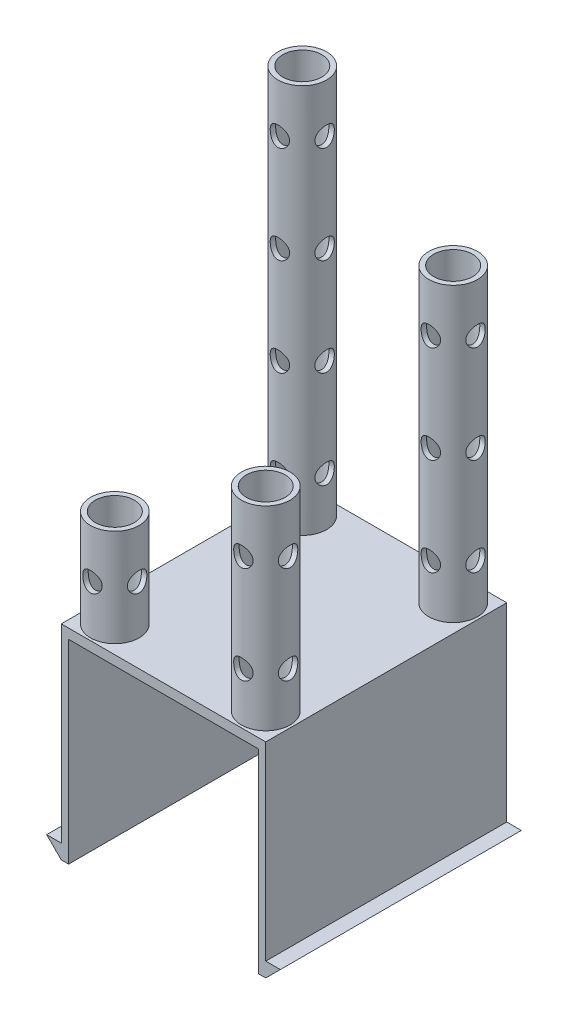
from build123d import *

# Parameters (mm, degrees)
SKETCH1_R                  = 30
SKETCH1_R_2                = 27.5
BOSS_EXTRUDE1_DEPTH        = 100
SKETCH1_2_R                = 27.5
BOSS_EXTRUDE2_DEPTH        = 5
SKETCH2_W                  = 1.5
SKETCH2_H                  = 49.5
BOSS_EXTRUDE3_DEPTH        = 40
SKETCH3_W                  = 42
SKETCH3_H                  = 49.5
BOSS_EXTRUDE4_DEPTH        = 2
BOSS_EXTRUDE5_DEPTH        = 49.5
SKETCH5_W                  = 73.198531936
SKETCH5_H                  = 63.388419408
CUT_EXTRUDE1_DEPTH         = 100
CUT_EXTRUDE2_START         = -5
CUT_EXTRUDE2_DEPTH         = 5
SKETCH8_R                  = 5
SKETCH8_R_2                = 4
BOSS_EXTRUDE6_DEPTH        = 80
SKETCH9_R                  = 2
CUT_EXTRUDE3_DEPTH         = 20
CIRPATTERN1_COUNT          = 4
LPATTERN1_COUNT            = 4
LPATTERN1_PITCH            = 20
LPATTERN1_COPY_1_SKETCH_R  = 2
LPATTERN1_COPY_1_DEPTH     = 20
LPATTERN1_COPY_2_SKETCH_R  = 2
LPATTERN1_COPY_2_DEPTH     = 20
LPATTERN1_COPY_3_SKETCH_R  = 2
LPATTERN1_COPY_3_DEPTH     = 20
LPATTERN1_COPY_4_SKETCH_R  = 2
LPATTERN1_COPY_4_DEPTH     = 20
LPATTERN1_COPY_5_SKETCH_R  = 2
LPATTERN1_COPY_5_DEPTH     = 20
LPATTERN1_COPY_6_SKETCH_R  = 2
LPATTERN1_COPY_6_DEPTH     = 20
LPATTERN1_COPY_7_SKETCH_R  = 2
LPATTERN1_COPY_7_DEPTH     = 20
LPATTERN1_COPY_8_SKETCH_R  = 2
LPATTERN1_COPY_8_DEPTH     = 20
LPATTERN1_COPY_9_SKETCH_R  = 2
LPATTERN1_COPY_9_DEPTH     = 20
LPATTERN2_COUNT            = 2
LPATTERN2_PITCH            = 38.5
LPATTERN2_COPY_1_SKETCH_R  = 2
LPATTERN2_COPY_1_DEPTH     = 20
LPATTERN2_COPY_2_SKETCH_R  = 2
LPATTERN2_COPY_2_DEPTH     = 20
LPATTERN2_COPY_3_SKETCH_R  = 2
LPATTERN2_COPY_3_DEPTH     = 20
LPATTERN2_COPY_4_SKETCH_R  = 2
LPATTERN2_COPY_4_DEPTH     = 20
LPATTERN2_COPY_5_SKETCH_R  = 2
LPATTERN2_COPY_5_DEPTH     = 20
LPATTERN2_COPY_6_SKETCH_R  = 2
LPATTERN2_COPY_6_DEPTH     = 20
LPATTERN2_COPY_7_SKETCH_R  = 2
LPATTERN2_COPY_7_DEPTH     = 20
LPATTERN2_COPY_8_SKETCH_R  = 2
LPATTERN2_COPY_8_DEPTH     = 20
LPATTERN2_COPY_9_SKETCH_R  = 2
LPATTERN2_COPY_9_DEPTH     = 20
LPATTERN2_COPY_10_SKETCH_R = 2
LPATTERN2_COPY_10_DEPTH    = 20
LPATTERN2_COPY_11_SKETCH_R = 2
LPATTERN2_COPY_11_DEPTH    = 20
LPATTERN2_COPY_12_SKETCH_R = 2
LPATTERN2_COPY_12_DEPTH    = 20
LPATTERN2_COPY_13_SKETCH_R = 2
LPATTERN2_COPY_13_DEPTH    = 20
LPATTERN2_COPY_14_SKETCH_R = 2
LPATTERN2_COPY_14_DEPTH    = 20
LPATTERN2_COPY_15_SKETCH_R = 2
LPATTERN2_COPY_15_DEPTH    = 20
LPATTERN3_COUNT            = 2
LPATTERN3_PITCH            = 31
LPATTERN3_COPY_1_SKETCH_R  = 2
LPATTERN3_COPY_1_DEPTH     = 20
LPATTERN3_COPY_2_SKETCH_R  = 2
LPATTERN3_COPY_2_DEPTH     = 20
LPATTERN3_COPY_3_SKETCH_R  = 2
LPATTERN3_COPY_3_DEPTH     = 20
LPATTERN3_COPY_4_SKETCH_R  = 2
LPATTERN3_COPY_4_DEPTH     = 20
LPATTERN3_COPY_5_SKETCH_R  = 2
LPATTERN3_COPY_5_DEPTH     = 20
LPATTERN3_COPY_6_SKETCH_R  = 2
LPATTERN3_COPY_6_DEPTH     = 20
LPATTERN3_COPY_7_SKETCH_R  = 2
LPATTERN3_COPY_7_DEPTH     = 20
LPATTERN3_COPY_8_SKETCH_R  = 2
LPATTERN3_COPY_8_DEPTH     = 20
LPATTERN3_COPY_9_SKETCH_R  = 2
LPATTERN3_COPY_9_DEPTH     = 20
LPATTERN3_COPY_10_SKETCH_R = 2
LPATTERN3_COPY_10_DEPTH    = 20
LPATTERN3_COPY_11_SKETCH_R = 2
LPATTERN3_COPY_11_DEPTH    = 20
LPATTERN3_COPY_12_SKETCH_R = 2
LPATTERN3_COPY_12_DEPTH    = 20
LPATTERN3_COPY_13_SKETCH_R = 2
LPATTERN3_COPY_13_DEPTH    = 20
LPATTERN3_COPY_14_SKETCH_R = 2
LPATTERN3_COPY_14_DEPTH    = 20
LPATTERN3_COPY_15_SKETCH_R = 2
LPATTERN3_COPY_15_DEPTH    = 20
LPATTERN3_COPY_16_SKETCH_R = 2
LPATTERN3_COPY_16_DEPTH    = 20
LPATTERN3_COPY_17_SKETCH_R = 2
LPATTERN3_COPY_17_DEPTH    = 20
LPATTERN3_COPY_18_SKETCH_R = 2
LPATTERN3_COPY_18_DEPTH    = 20
LPATTERN3_COPY_19_SKETCH_R = 2
LPATTERN3_COPY_19_DEPTH    = 20
LPATTERN3_COPY_20_SKETCH_R = 2
LPATTERN3_COPY_20_DEPTH    = 20
LPATTERN3_COPY_21_SKETCH_R = 2
LPATTERN3_COPY_21_DEPTH    = 20
LPATTERN3_COPY_22_SKETCH_R = 2
LPATTERN3_COPY_22_DEPTH    = 20
LPATTERN3_COPY_23_SKETCH_R = 2
LPATTERN3_COPY_23_DEPTH    = 20
LPATTERN3_COPY_24_SKETCH_R = 2
LPATTERN3_COPY_24_DEPTH    = 20
LPATTERN3_COPY_25_SKETCH_R = 2
LPATTERN3_COPY_25_DEPTH    = 20
LPATTERN3_COPY_26_SKETCH_R = 2
LPATTERN3_COPY_26_DEPTH    = 20
LPATTERN3_COPY_27_SKETCH_R = 2
LPATTERN3_COPY_27_DEPTH    = 20
LPATTERN3_COPY_28_SKETCH_R = 2
LPATTERN3_COPY_28_DEPTH    = 20
LPATTERN3_COPY_29_SKETCH_R = 2
LPATTERN3_COPY_29_DEPTH    = 20
LPATTERN3_COPY_30_SKETCH_R = 2
LPATTERN3_COPY_30_DEPTH    = 20
LPATTERN3_COPY_31_SKETCH_R = 2
LPATTERN3_COPY_31_DEPTH    = 20
CUT_EXTRUDE4_START         = -20
SKETCH10_R                 = 5
SKETCH10_R_2               = 4
CUT_EXTRUDE4_DEPTH         = 20
SKETCH10_3_W               = 25.68894856
SKETCH10_3_H               = 21.279129053
CUT_EXTRUDE5_DEPTH         = 40
SKETCH10_4_W               = 21.279129053
SKETCH10_4_H               = 18.199255111
CUT_EXTRUDE6_DEPTH         = 60


with BuildPart() as part:
    # Sketch1 → Boss-Extrude1 (new body)
    with BuildSketch(Plane(origin=(0, 0, 0), x_dir=(1, 0, 0), z_dir=(0, 1, 0))):
        with Locations(Location((0, 0, 0), (0, 0, 270))):
            Circle(SKETCH1_R)
        with Locations(Location((0, 0, 0), (0, 0, 270))):
            Circle(SKETCH1_R_2, mode=Mode.SUBTRACT)
    extrude(amount=BOSS_EXTRUDE1_DEPTH)

    # Sketch1<2> → Boss-Extrude2 (add)
    with BuildSketch(Plane(origin=(0, 0, 0), x_dir=(1, 0, 0), z_dir=(0, 1, 0))):
        with Locations(Location((0, 0, 0), (0, 0, 270))):
            Circle(SKETCH1_2_R)
    extrude(amount=BOSS_EXTRUDE2_DEPTH)

    # Sketch2 → Boss-Extrude3 (add)
    with BuildSketch(Plane.XZ):
        with Locations((-20.25, 0)):
            Rectangle(SKETCH2_W, SKETCH2_H)
        with Locations((20.25, 0)):
            Rectangle(SKETCH2_W, SKETCH2_H)
    extrude(amount=BOSS_EXTRUDE3_DEPTH)

    # Sketch3 → Boss-Extrude4 (add)
    with BuildSketch(Plane.XZ):
        Rectangle(SKETCH3_W, SKETCH3_H)
    extrude(amount=-BOSS_EXTRUDE4_DEPTH)

    # Sketch4 → Boss-Extrude5 (add)
    with BuildSketch(Plane(origin=(0, 0, -24.75), x_dir=(-1, 0, 0), z_dir=(0, 0, -1))):
        Polygon((21, -40), (24, -37), (21, -37), align=None)
        Polygon((-21, -40), (-24, -37), (-21, -37), align=None)
    extrude(amount=-BOSS_EXTRUDE5_DEPTH)

    # Sketch5 → Cut-Extrude1 (cut)
    with BuildSketch(Plane(origin=(0, 2, 0), x_dir=(1, 0, 0), z_dir=(0, 1, 0))):
        with Locations((-1.760789428, 1.131936061)):
            Rectangle(SKETCH5_W, SKETCH5_H)
    extrude(amount=CUT_EXTRUDE1_DEPTH, mode=Mode.SUBTRACT)

    # Sketch7 → Cut-Extrude2 (cut)
    with BuildSketch(Plane(origin=(0, 2, 0), x_dir=(1, 0, 0), z_dir=(0, 1, 0)).offset(CUT_EXTRUDE2_START)):
        with BuildLine():
            Line((-21, 24.75), (-27.699143617, 24.75))
            Line((-27.699143617, 24.75), (-38.524669613, 24.75))
            Line((-38.524669613, 24.75), (-38.524669613, -26.230735856))
            Line((-38.524669613, -26.230735856), (-25.435271495, -26.230735856))
            Line((-25.435271495, -26.230735856), (-25.435271495, -24.75))
            Line((-25.435271495, -24.75), (-21, -24.75))
            Line((-21, -24.75), (-21, -21.424285286))
            ThreePointArc((-21, -21.424285286), (-30, 0), (-21, 21.424285286))
            Line((-21, 21.424285286), (-21, 24.75))
        make_face()
        with BuildLine():
            Line((-21, -21.424285286), (-21, 21.424285286))
            ThreePointArc((-21, 21.424285286), (-30, 0), (-21, -21.424285286))
        make_face()
        with BuildLine():
            ThreePointArc((16.953981833, 24.75), (0, 30), (-16.953981833, 24.75))
            Line((-16.953981833, 24.75), (16.953981833, 24.75))
        make_face()
        with BuildLine():
            ThreePointArc((21, -21.424285286), (30, 0), (21, 21.424285286))
            Line((21, 21.424285286), (21, -21.424285286))
        make_face()
        with BuildLine():
            Line((16.953981833, -24.75), (-16.953981833, -24.75))
            ThreePointArc((-16.953981833, -24.75), (0, -30), (16.953981833, -24.75))
        make_face()
    extrude(amount=CUT_EXTRUDE2_DEPTH, mode=Mode.SUBTRACT)

    # Sketch8 → Boss-Extrude6 (add)
    # profile 1 of 4: a face of its own
    with BuildSketch(Plane(origin=(0, 2, 0), x_dir=(1, 0, 0), z_dir=(0, 1, 0))):
        with Locations(Location((-15.5, 19.25, 0), (0, 0, 270))):
            Circle(SKETCH8_R)
        with Locations(Location((-15.5, 19.25, 0), (0, 0, 270))):
            Circle(SKETCH8_R_2, mode=Mode.SUBTRACT)
    # profile 2 of 4: a face of its own
    with BuildSketch(Plane(origin=(0, 2, 0), x_dir=(1, 0, 0), z_dir=(0, 1, 0))):
        with Locations(Location((15.5, 19.25, 0), (0, 0, 270))):
            Circle(SKETCH8_R)
        with Locations(Location((15.5, 19.25, 0), (0, 0, 270))):
            Circle(SKETCH8_R_2, mode=Mode.SUBTRACT)
    # profile 3 of 4: a face of its own
    with BuildSketch(Plane(origin=(0, 2, 0), x_dir=(1, 0, 0), z_dir=(0, 1, 0))):
        with Locations(Location((-15.5, -19.25, 0), (0, 0, 270))):
            Circle(SKETCH8_R)
        with Locations(Location((-15.5, -19.25, 0), (0, 0, 270))):
            Circle(SKETCH8_R_2, mode=Mode.SUBTRACT)
    # profile 4 of 4: a face of its own
    with BuildSketch(Plane(origin=(0, 2, 0), x_dir=(1, 0, 0), z_dir=(0, 1, 0))):
        with Locations(Location((15.5, -19.25, 0), (0, 0, 270))):
            Circle(SKETCH8_R)
        with Locations(Location((15.5, -19.25, 0), (0, 0, 270))):
            Circle(SKETCH8_R_2, mode=Mode.SUBTRACT)
    extrude(amount=BOSS_EXTRUDE6_DEPTH)

    # Sketch9 → Cut-Extrude3 (cut)
    with BuildSketch(Plane.ZY.offset(21)):
        with Locations((-19.25, 72)):
            Circle(SKETCH9_R)
    cut_extrude3 = extrude(amount=-CUT_EXTRUDE3_DEPTH, mode=Mode.SUBTRACT)

    # CirPattern1: Cut-Extrude3 ×4 about axis
    cirpattern1_axis = Axis((-15.5, 82, -19.25), (0, 1, 0))
    for i in range(1, CIRPATTERN1_COUNT):
        add(cut_extrude3.rotate(cirpattern1_axis, i * 360 / CIRPATTERN1_COUNT), mode=Mode.SUBTRACT)

    # LPattern1: Cut-Extrude3 ×4
    with Locations(*[(0, -i * LPATTERN1_PITCH, 0) for i in range(1, LPATTERN1_COUNT)]):
        add(cut_extrude3, mode=Mode.SUBTRACT)

    # LPattern1 copy 1 sketch → LPattern1 copy 1 (cut)
    with BuildSketch(Plane(origin=(3.75, -20, -13.75), x_dir=(1, 0, 0), z_dir=(0, 0, 1))):
        with Locations((-19.25, 72)):
            Circle(LPATTERN1_COPY_1_SKETCH_R)
    extrude(amount=-LPATTERN1_COPY_1_DEPTH, mode=Mode.SUBTRACT)

    # LPattern1 copy 2 sketch → LPattern1 copy 2 (cut)
    with BuildSketch(Plane(origin=(3.75, -40, -13.75), x_dir=(1, 0, 0), z_dir=(0, 0, 1))):
        with Locations((-19.25, 72)):
            Circle(LPATTERN1_COPY_2_SKETCH_R)
    extrude(amount=-LPATTERN1_COPY_2_DEPTH, mode=Mode.SUBTRACT)

    # LPattern1 copy 3 sketch → LPattern1 copy 3 (cut)
    with BuildSketch(Plane(origin=(3.75, -60, -13.75), x_dir=(1, 0, 0), z_dir=(0, 0, 1))):
        with Locations((-19.25, 72)):
            Circle(LPATTERN1_COPY_3_SKETCH_R)
    extrude(amount=-LPATTERN1_COPY_3_DEPTH, mode=Mode.SUBTRACT)

    # LPattern1 copy 4 sketch → LPattern1 copy 4 (cut)
    with BuildSketch(Plane(origin=(-10, -20, -38.5), x_dir=(0, 0, -1), z_dir=(1, 0, 0))):
        with Locations((-19.25, 72)):
            Circle(LPATTERN1_COPY_4_SKETCH_R)
    extrude(amount=-LPATTERN1_COPY_4_DEPTH, mode=Mode.SUBTRACT)

    # LPattern1 copy 5 sketch → LPattern1 copy 5 (cut)
    with BuildSketch(Plane(origin=(-10, -40, -38.5), x_dir=(0, 0, -1), z_dir=(1, 0, 0))):
        with Locations((-19.25, 72)):
            Circle(LPATTERN1_COPY_5_SKETCH_R)
    extrude(amount=-LPATTERN1_COPY_5_DEPTH, mode=Mode.SUBTRACT)

    # LPattern1 copy 6 sketch → LPattern1 copy 6 (cut)
    with BuildSketch(Plane(origin=(-10, -60, -38.5), x_dir=(0, 0, -1), z_dir=(1, 0, 0))):
        with Locations((-19.25, 72)):
            Circle(LPATTERN1_COPY_6_SKETCH_R)
    extrude(amount=-LPATTERN1_COPY_6_DEPTH, mode=Mode.SUBTRACT)

    # LPattern1 copy 7 sketch → LPattern1 copy 7 (cut)
    with BuildSketch(Plane(origin=(-34.75, -20, -24.75), x_dir=(-1, 0, 0), z_dir=(0, 0, -1))):
        with Locations((-19.25, 72)):
            Circle(LPATTERN1_COPY_7_SKETCH_R)
    extrude(amount=-LPATTERN1_COPY_7_DEPTH, mode=Mode.SUBTRACT)

    # LPattern1 copy 8 sketch → LPattern1 copy 8 (cut)
    with BuildSketch(Plane(origin=(-34.75, -40, -24.75), x_dir=(-1, 0, 0), z_dir=(0, 0, -1))):
        with Locations((-19.25, 72)):
            Circle(LPATTERN1_COPY_8_SKETCH_R)
    extrude(amount=-LPATTERN1_COPY_8_DEPTH, mode=Mode.SUBTRACT)

    # LPattern1 copy 9 sketch → LPattern1 copy 9 (cut)
    with BuildSketch(Plane(origin=(-34.75, -60, -24.75), x_dir=(-1, 0, 0), z_dir=(0, 0, -1))):
        with Locations((-19.25, 72)):
            Circle(LPATTERN1_COPY_9_SKETCH_R)
    extrude(amount=-LPATTERN1_COPY_9_DEPTH, mode=Mode.SUBTRACT)

    # LPattern2: Cut-Extrude3 ×2
    with Locations(*[(0, 0, i * LPATTERN2_PITCH) for i in range(1, LPATTERN2_COUNT)]):
        add(cut_extrude3, mode=Mode.SUBTRACT)

    # LPattern2 copy 1 sketch → LPattern2 copy 1 (cut)
    with BuildSketch(Plane(origin=(3.75, 0, 24.75), x_dir=(1, 0, 0), z_dir=(0, 0, 1))):
        with Locations((-19.25, 72)):
            Circle(LPATTERN2_COPY_1_SKETCH_R)
    extrude(amount=-LPATTERN2_COPY_1_DEPTH, mode=Mode.SUBTRACT)

    # LPattern2 copy 2 sketch → LPattern2 copy 2 (cut)
    with BuildSketch(Plane(origin=(-10, 0, 0), x_dir=(0, 0, -1), z_dir=(1, 0, 0))):
        with Locations((-19.25, 72)):
            Circle(LPATTERN2_COPY_2_SKETCH_R)
    extrude(amount=-LPATTERN2_COPY_2_DEPTH, mode=Mode.SUBTRACT)

    # LPattern2 copy 3 sketch → LPattern2 copy 3 (cut)
    with BuildSketch(Plane(origin=(-34.75, 0, 13.75), x_dir=(-1, 0, 0), z_dir=(0, 0, -1))):
        with Locations((-19.25, 72)):
            Circle(LPATTERN2_COPY_3_SKETCH_R)
    extrude(amount=-LPATTERN2_COPY_3_DEPTH, mode=Mode.SUBTRACT)

    # LPattern2 copy 4 sketch → LPattern2 copy 4 (cut)
    with BuildSketch(Plane(origin=(-21, -20, 38.5), x_dir=(0, 0, 1), z_dir=(-1, 0, 0))):
        with Locations((-19.25, 72)):
            Circle(LPATTERN2_COPY_4_SKETCH_R)
    extrude(amount=-LPATTERN2_COPY_4_DEPTH, mode=Mode.SUBTRACT)

    # LPattern2 copy 5 sketch → LPattern2 copy 5 (cut)
    with BuildSketch(Plane(origin=(-21, -40, 38.5), x_dir=(0, 0, 1), z_dir=(-1, 0, 0))):
        with Locations((-19.25, 72)):
            Circle(LPATTERN2_COPY_5_SKETCH_R)
    extrude(amount=-LPATTERN2_COPY_5_DEPTH, mode=Mode.SUBTRACT)

    # LPattern2 copy 6 sketch → LPattern2 copy 6 (cut)
    with BuildSketch(Plane(origin=(-21, -60, 38.5), x_dir=(0, 0, 1), z_dir=(-1, 0, 0))):
        with Locations((-19.25, 72)):
            Circle(LPATTERN2_COPY_6_SKETCH_R)
    extrude(amount=-LPATTERN2_COPY_6_DEPTH, mode=Mode.SUBTRACT)

    # LPattern2 copy 7 sketch → LPattern2 copy 7 (cut)
    with BuildSketch(Plane(origin=(3.75, -20, 24.75), x_dir=(1, 0, 0), z_dir=(0, 0, 1))):
        with Locations((-19.25, 72)):
            Circle(LPATTERN2_COPY_7_SKETCH_R)
    extrude(amount=-LPATTERN2_COPY_7_DEPTH, mode=Mode.SUBTRACT)

    # LPattern2 copy 8 sketch → LPattern2 copy 8 (cut)
    with BuildSketch(Plane(origin=(3.75, -40, 24.75), x_dir=(1, 0, 0), z_dir=(0, 0, 1))):
        with Locations((-19.25, 72)):
            Circle(LPATTERN2_COPY_8_SKETCH_R)
    extrude(amount=-LPATTERN2_COPY_8_DEPTH, mode=Mode.SUBTRACT)

    # LPattern2 copy 9 sketch → LPattern2 copy 9 (cut)
    with BuildSketch(Plane(origin=(3.75, -60, 24.75), x_dir=(1, 0, 0), z_dir=(0, 0, 1))):
        with Locations((-19.25, 72)):
            Circle(LPATTERN2_COPY_9_SKETCH_R)
    extrude(amount=-LPATTERN2_COPY_9_DEPTH, mode=Mode.SUBTRACT)

    # LPattern2 copy 10 sketch → LPattern2 copy 10 (cut)
    with BuildSketch(Plane(origin=(-10, -20, 0), x_dir=(0, 0, -1), z_dir=(1, 0, 0))):
        with Locations((-19.25, 72)):
            Circle(LPATTERN2_COPY_10_SKETCH_R)
    extrude(amount=-LPATTERN2_COPY_10_DEPTH, mode=Mode.SUBTRACT)

    # LPattern2 copy 11 sketch → LPattern2 copy 11 (cut)
    with BuildSketch(Plane(origin=(-10, -40, 0), x_dir=(0, 0, -1), z_dir=(1, 0, 0))):
        with Locations((-19.25, 72)):
            Circle(LPATTERN2_COPY_11_SKETCH_R)
    extrude(amount=-LPATTERN2_COPY_11_DEPTH, mode=Mode.SUBTRACT)

    # LPattern2 copy 12 sketch → LPattern2 copy 12 (cut)
    with BuildSketch(Plane(origin=(-10, -60, 0), x_dir=(0, 0, -1), z_dir=(1, 0, 0))):
        with Locations((-19.25, 72)):
            Circle(LPATTERN2_COPY_12_SKETCH_R)
    extrude(amount=-LPATTERN2_COPY_12_DEPTH, mode=Mode.SUBTRACT)

    # LPattern2 copy 13 sketch → LPattern2 copy 13 (cut)
    with BuildSketch(Plane(origin=(-34.75, -20, 13.75), x_dir=(-1, 0, 0), z_dir=(0, 0, -1))):
        with Locations((-19.25, 72)):
            Circle(LPATTERN2_COPY_13_SKETCH_R)
    extrude(amount=-LPATTERN2_COPY_13_DEPTH, mode=Mode.SUBTRACT)

    # LPattern2 copy 14 sketch → LPattern2 copy 14 (cut)
    with BuildSketch(Plane(origin=(-34.75, -40, 13.75), x_dir=(-1, 0, 0), z_dir=(0, 0, -1))):
        with Locations((-19.25, 72)):
            Circle(LPATTERN2_COPY_14_SKETCH_R)
    extrude(amount=-LPATTERN2_COPY_14_DEPTH, mode=Mode.SUBTRACT)

    # LPattern2 copy 15 sketch → LPattern2 copy 15 (cut)
    with BuildSketch(Plane(origin=(-34.75, -60, 13.75), x_dir=(-1, 0, 0), z_dir=(0, 0, -1))):
        with Locations((-19.25, 72)):
            Circle(LPATTERN2_COPY_15_SKETCH_R)
    extrude(amount=-LPATTERN2_COPY_15_DEPTH, mode=Mode.SUBTRACT)

    # LPattern3: Cut-Extrude3 ×2
    with Locations(*[(i * LPATTERN3_PITCH, 0, 0) for i in range(1, LPATTERN3_COUNT)]):
        add(cut_extrude3, mode=Mode.SUBTRACT)

    # LPattern3 copy 1 sketch → LPattern3 copy 1 (cut)
    with BuildSketch(Plane(origin=(34.75, 0, -13.75), x_dir=(1, 0, 0), z_dir=(0, 0, 1))):
        with Locations((-19.25, 72)):
            Circle(LPATTERN3_COPY_1_SKETCH_R)
    extrude(amount=-LPATTERN3_COPY_1_DEPTH, mode=Mode.SUBTRACT)

    # LPattern3 copy 2 sketch → LPattern3 copy 2 (cut)
    with BuildSketch(Plane(origin=(21, 0, -38.5), x_dir=(0, 0, -1), z_dir=(1, 0, 0))):
        with Locations((-19.25, 72)):
            Circle(LPATTERN3_COPY_2_SKETCH_R)
    extrude(amount=-LPATTERN3_COPY_2_DEPTH, mode=Mode.SUBTRACT)

    # LPattern3 copy 3 sketch → LPattern3 copy 3 (cut)
    with BuildSketch(Plane(origin=(-3.75, 0, -24.75), x_dir=(-1, 0, 0), z_dir=(0, 0, -1))):
        with Locations((-19.25, 72)):
            Circle(LPATTERN3_COPY_3_SKETCH_R)
    extrude(amount=-LPATTERN3_COPY_3_DEPTH, mode=Mode.SUBTRACT)

    # LPattern3 copy 4 sketch → LPattern3 copy 4 (cut)
    with BuildSketch(Plane(origin=(10, -20, 0), x_dir=(0, 0, 1), z_dir=(-1, 0, 0))):
        with Locations((-19.25, 72)):
            Circle(LPATTERN3_COPY_4_SKETCH_R)
    extrude(amount=-LPATTERN3_COPY_4_DEPTH, mode=Mode.SUBTRACT)

    # LPattern3 copy 5 sketch → LPattern3 copy 5 (cut)
    with BuildSketch(Plane(origin=(10, -40, 0), x_dir=(0, 0, 1), z_dir=(-1, 0, 0))):
        with Locations((-19.25, 72)):
            Circle(LPATTERN3_COPY_5_SKETCH_R)
    extrude(amount=-LPATTERN3_COPY_5_DEPTH, mode=Mode.SUBTRACT)

    # LPattern3 copy 6 sketch → LPattern3 copy 6 (cut)
    with BuildSketch(Plane(origin=(10, -60, 0), x_dir=(0, 0, 1), z_dir=(-1, 0, 0))):
        with Locations((-19.25, 72)):
            Circle(LPATTERN3_COPY_6_SKETCH_R)
    extrude(amount=-LPATTERN3_COPY_6_DEPTH, mode=Mode.SUBTRACT)

    # LPattern3 copy 7 sketch → LPattern3 copy 7 (cut)
    with BuildSketch(Plane(origin=(34.75, -20, -13.75), x_dir=(1, 0, 0), z_dir=(0, 0, 1))):
        with Locations((-19.25, 72)):
            Circle(LPATTERN3_COPY_7_SKETCH_R)
    extrude(amount=-LPATTERN3_COPY_7_DEPTH, mode=Mode.SUBTRACT)

    # LPattern3 copy 8 sketch → LPattern3 copy 8 (cut)
    with BuildSketch(Plane(origin=(34.75, -40, -13.75), x_dir=(1, 0, 0), z_dir=(0, 0, 1))):
        with Locations((-19.25, 72)):
            Circle(LPATTERN3_COPY_8_SKETCH_R)
    extrude(amount=-LPATTERN3_COPY_8_DEPTH, mode=Mode.SUBTRACT)

    # LPattern3 copy 9 sketch → LPattern3 copy 9 (cut)
    with BuildSketch(Plane(origin=(34.75, -60, -13.75), x_dir=(1, 0, 0), z_dir=(0, 0, 1))):
        with Locations((-19.25, 72)):
            Circle(LPATTERN3_COPY_9_SKETCH_R)
    extrude(amount=-LPATTERN3_COPY_9_DEPTH, mode=Mode.SUBTRACT)

    # LPattern3 copy 10 sketch → LPattern3 copy 10 (cut)
    with BuildSketch(Plane(origin=(21, -20, -38.5), x_dir=(0, 0, -1), z_dir=(1, 0, 0))):
        with Locations((-19.25, 72)):
            Circle(LPATTERN3_COPY_10_SKETCH_R)
    extrude(amount=-LPATTERN3_COPY_10_DEPTH, mode=Mode.SUBTRACT)

    # LPattern3 copy 11 sketch → LPattern3 copy 11 (cut)
    with BuildSketch(Plane(origin=(21, -40, -38.5), x_dir=(0, 0, -1), z_dir=(1, 0, 0))):
        with Locations((-19.25, 72)):
            Circle(LPATTERN3_COPY_11_SKETCH_R)
    extrude(amount=-LPATTERN3_COPY_11_DEPTH, mode=Mode.SUBTRACT)

    # LPattern3 copy 12 sketch → LPattern3 copy 12 (cut)
    with BuildSketch(Plane(origin=(21, -60, -38.5), x_dir=(0, 0, -1), z_dir=(1, 0, 0))):
        with Locations((-19.25, 72)):
            Circle(LPATTERN3_COPY_12_SKETCH_R)
    extrude(amount=-LPATTERN3_COPY_12_DEPTH, mode=Mode.SUBTRACT)

    # LPattern3 copy 13 sketch → LPattern3 copy 13 (cut)
    with BuildSketch(Plane(origin=(-3.75, -20, -24.75), x_dir=(-1, 0, 0), z_dir=(0, 0, -1))):
        with Locations((-19.25, 72)):
            Circle(LPATTERN3_COPY_13_SKETCH_R)
    extrude(amount=-LPATTERN3_COPY_13_DEPTH, mode=Mode.SUBTRACT)

    # LPattern3 copy 14 sketch → LPattern3 copy 14 (cut)
    with BuildSketch(Plane(origin=(-3.75, -40, -24.75), x_dir=(-1, 0, 0), z_dir=(0, 0, -1))):
        with Locations((-19.25, 72)):
            Circle(LPATTERN3_COPY_14_SKETCH_R)
    extrude(amount=-LPATTERN3_COPY_14_DEPTH, mode=Mode.SUBTRACT)

    # LPattern3 copy 15 sketch → LPattern3 copy 15 (cut)
    with BuildSketch(Plane(origin=(-3.75, -60, -24.75), x_dir=(-1, 0, 0), z_dir=(0, 0, -1))):
        with Locations((-19.25, 72)):
            Circle(LPATTERN3_COPY_15_SKETCH_R)
    extrude(amount=-LPATTERN3_COPY_15_DEPTH, mode=Mode.SUBTRACT)

    # LPattern3 copy 16 sketch → LPattern3 copy 16 (cut)
    with BuildSketch(Plane(origin=(10, 0, 38.5), x_dir=(0, 0, 1), z_dir=(-1, 0, 0))):
        with Locations((-19.25, 72)):
            Circle(LPATTERN3_COPY_16_SKETCH_R)
    extrude(amount=-LPATTERN3_COPY_16_DEPTH, mode=Mode.SUBTRACT)

    # LPattern3 copy 17 sketch → LPattern3 copy 17 (cut)
    with BuildSketch(Plane(origin=(34.75, 0, 24.75), x_dir=(1, 0, 0), z_dir=(0, 0, 1))):
        with Locations((-19.25, 72)):
            Circle(LPATTERN3_COPY_17_SKETCH_R)
    extrude(amount=-LPATTERN3_COPY_17_DEPTH, mode=Mode.SUBTRACT)

    # LPattern3 copy 18 sketch → LPattern3 copy 18 (cut)
    with BuildSketch(Plane(origin=(21, 0, 0), x_dir=(0, 0, -1), z_dir=(1, 0, 0))):
        with Locations((-19.25, 72)):
            Circle(LPATTERN3_COPY_18_SKETCH_R)
    extrude(amount=-LPATTERN3_COPY_18_DEPTH, mode=Mode.SUBTRACT)

    # LPattern3 copy 19 sketch → LPattern3 copy 19 (cut)
    with BuildSketch(Plane(origin=(-3.75, 0, 13.75), x_dir=(-1, 0, 0), z_dir=(0, 0, -1))):
        with Locations((-19.25, 72)):
            Circle(LPATTERN3_COPY_19_SKETCH_R)
    extrude(amount=-LPATTERN3_COPY_19_DEPTH, mode=Mode.SUBTRACT)

    # LPattern3 copy 20 sketch → LPattern3 copy 20 (cut)
    with BuildSketch(Plane(origin=(10, -20, 38.5), x_dir=(0, 0, 1), z_dir=(-1, 0, 0))):
        with Locations((-19.25, 72)):
            Circle(LPATTERN3_COPY_20_SKETCH_R)
    extrude(amount=-LPATTERN3_COPY_20_DEPTH, mode=Mode.SUBTRACT)

    # LPattern3 copy 21 sketch → LPattern3 copy 21 (cut)
    with BuildSketch(Plane(origin=(10, -40, 38.5), x_dir=(0, 0, 1), z_dir=(-1, 0, 0))):
        with Locations((-19.25, 72)):
            Circle(LPATTERN3_COPY_21_SKETCH_R)
    extrude(amount=-LPATTERN3_COPY_21_DEPTH, mode=Mode.SUBTRACT)

    # LPattern3 copy 22 sketch → LPattern3 copy 22 (cut)
    with BuildSketch(Plane(origin=(10, -60, 38.5), x_dir=(0, 0, 1), z_dir=(-1, 0, 0))):
        with Locations((-19.25, 72)):
            Circle(LPATTERN3_COPY_22_SKETCH_R)
    extrude(amount=-LPATTERN3_COPY_22_DEPTH, mode=Mode.SUBTRACT)

    # LPattern3 copy 23 sketch → LPattern3 copy 23 (cut)
    with BuildSketch(Plane(origin=(34.75, -20, 24.75), x_dir=(1, 0, 0), z_dir=(0, 0, 1))):
        with Locations((-19.25, 72)):
            Circle(LPATTERN3_COPY_23_SKETCH_R)
    extrude(amount=-LPATTERN3_COPY_23_DEPTH, mode=Mode.SUBTRACT)

    # LPattern3 copy 24 sketch → LPattern3 copy 24 (cut)
    with BuildSketch(Plane(origin=(34.75, -40, 24.75), x_dir=(1, 0, 0), z_dir=(0, 0, 1))):
        with Locations((-19.25, 72)):
            Circle(LPATTERN3_COPY_24_SKETCH_R)
    extrude(amount=-LPATTERN3_COPY_24_DEPTH, mode=Mode.SUBTRACT)

    # LPattern3 copy 25 sketch → LPattern3 copy 25 (cut)
    with BuildSketch(Plane(origin=(34.75, -60, 24.75), x_dir=(1, 0, 0), z_dir=(0, 0, 1))):
        with Locations((-19.25, 72)):
            Circle(LPATTERN3_COPY_25_SKETCH_R)
    extrude(amount=-LPATTERN3_COPY_25_DEPTH, mode=Mode.SUBTRACT)

    # LPattern3 copy 26 sketch → LPattern3 copy 26 (cut)
    with BuildSketch(Plane(origin=(21, -20, 0), x_dir=(0, 0, -1), z_dir=(1, 0, 0))):
        with Locations((-19.25, 72)):
            Circle(LPATTERN3_COPY_26_SKETCH_R)
    extrude(amount=-LPATTERN3_COPY_26_DEPTH, mode=Mode.SUBTRACT)

    # LPattern3 copy 27 sketch → LPattern3 copy 27 (cut)
    with BuildSketch(Plane(origin=(21, -40, 0), x_dir=(0, 0, -1), z_dir=(1, 0, 0))):
        with Locations((-19.25, 72)):
            Circle(LPATTERN3_COPY_27_SKETCH_R)
    extrude(amount=-LPATTERN3_COPY_27_DEPTH, mode=Mode.SUBTRACT)

    # LPattern3 copy 28 sketch → LPattern3 copy 28 (cut)
    with BuildSketch(Plane(origin=(21, -60, 0), x_dir=(0, 0, -1), z_dir=(1, 0, 0))):
        with Locations((-19.25, 72)):
            Circle(LPATTERN3_COPY_28_SKETCH_R)
    extrude(amount=-LPATTERN3_COPY_28_DEPTH, mode=Mode.SUBTRACT)

    # LPattern3 copy 29 sketch → LPattern3 copy 29 (cut)
    with BuildSketch(Plane(origin=(-3.75, -20, 13.75), x_dir=(-1, 0, 0), z_dir=(0, 0, -1))):
        with Locations((-19.25, 72)):
            Circle(LPATTERN3_COPY_29_SKETCH_R)
    extrude(amount=-LPATTERN3_COPY_29_DEPTH, mode=Mode.SUBTRACT)

    # LPattern3 copy 30 sketch → LPattern3 copy 30 (cut)
    with BuildSketch(Plane(origin=(-3.75, -40, 13.75), x_dir=(-1, 0, 0), z_dir=(0, 0, -1))):
        with Locations((-19.25, 72)):
            Circle(LPATTERN3_COPY_30_SKETCH_R)
    extrude(amount=-LPATTERN3_COPY_30_DEPTH, mode=Mode.SUBTRACT)

    # LPattern3 copy 31 sketch → LPattern3 copy 31 (cut)
    with BuildSketch(Plane(origin=(-3.75, -60, 13.75), x_dir=(-1, 0, 0), z_dir=(0, 0, -1))):
        with Locations((-19.25, 72)):
            Circle(LPATTERN3_COPY_31_SKETCH_R)
    extrude(amount=-LPATTERN3_COPY_31_DEPTH, mode=Mode.SUBTRACT)

    # Sketch10 → Cut-Extrude4 (cut)
    with BuildSketch(Plane(origin=(0, 82, 0), x_dir=(1, 0, 0), z_dir=(0, 1, 0)).offset(CUT_EXTRUDE4_START)):
        with Locations(Location((15.5, 19.25, 0), (0, 0, 270))):
            Circle(SKETCH10_R)
        with Locations(Location((15.5, 19.25, 0), (0, 0, 270))):
            Circle(SKETCH10_R_2, mode=Mode.SUBTRACT)
    extrude(amount=CUT_EXTRUDE4_DEPTH, mode=Mode.SUBTRACT)

    # Sketch10<3> → Cut-Extrude5 (cut)
    with BuildSketch(Plane(origin=(0, 82, 0), x_dir=(1, 0, 0), z_dir=(0, 1, 0))):
        with Locations((18.113255296, -17.099728854)):
            Rectangle(SKETCH10_3_W, SKETCH10_3_H)
    extrude(amount=-CUT_EXTRUDE5_DEPTH, mode=Mode.SUBTRACT)

    # Sketch10<4> → Cut-Extrude6 (cut)
    with BuildSketch(Plane(origin=(0, 82, 0), x_dir=(1, 0, 0), z_dir=(0, 1, 0))):
        with Locations((-17.480287874, -18.639665824)):
            Rectangle(SKETCH10_4_W, SKETCH10_4_H)
    extrude(amount=-CUT_EXTRUDE6_DEPTH, mode=Mode.SUBTRACT)


solid = part.part
